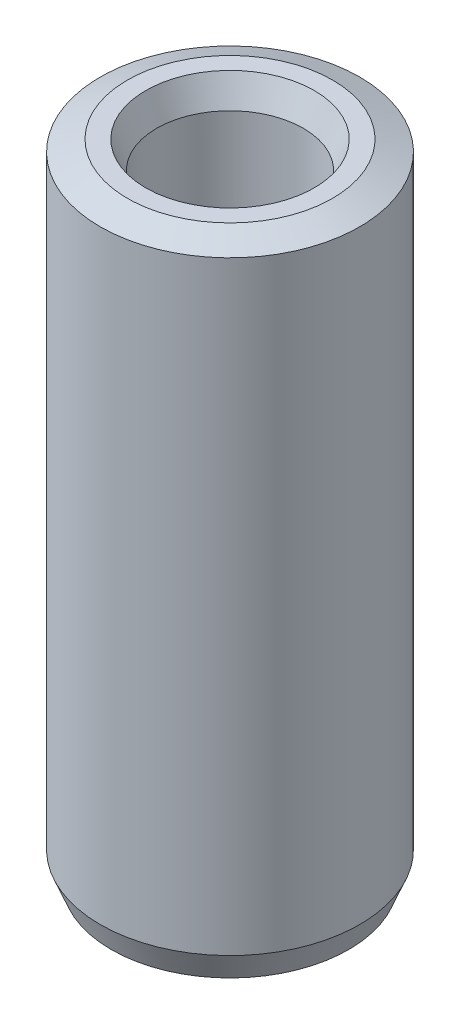
from build123d import *
from OCP.BRepFilletAPI import BRepFilletAPI_MakeChamfer

# Parameters (mm, degrees)
SKETCH1_R           = 42.5
BOSS_EXTRUDE1_DEPTH = 210.453476228
SKETCH2_R           = 24.009479227
CUT_EXTRUDE1_DEPTH  = 219.867918289
CHAMFER1_SIZE       = 3.603964877
CHAMFER1_SIZE2      = 8.904647738


with BuildPart() as part:
    # Sketch1 → Boss-Extrude1 (new body)
    with BuildSketch(Plane(origin=(0, 0, 0), x_dir=(1, 0, 0), z_dir=(0, 1, 0))):
        Circle(SKETCH1_R)
    extrude(amount=BOSS_EXTRUDE1_DEPTH)

    # Sketch2 → Cut-Extrude1 (cut, through all)
    with BuildSketch(Plane(origin=(0, 0, 0), x_dir=(1, 0, 0), z_dir=(0, 1, 0))):
        Circle(SKETCH2_R)
    extrude(amount=CUT_EXTRUDE1_DEPTH, mode=Mode.SUBTRACT)

    # Chamfer1: one chamfer whose edges measure the first distance from different faces: ONE call of the kernel's chamfer builder (chamfer() names one face for all edges)
    chamfer1_edges_1 = [part.edges().sort_by_distance(p)[0] for p in [
        (-24.009479227, 210.453476228, 0),
    ]]
    chamfer1_side_1 = [part.faces().sort_by_distance(p)[0] for p in [
        (-41.297918472, 210.453476228, 0),
    ]]
    chamfer1_edges_2 = [part.edges().sort_by_distance(p)[0] for p in [
        (-24.009479227, 0, 0),
    ]]
    chamfer1_side_2 = [part.faces().sort_by_distance(p)[0] for p in [
        (-24.009479227, 105.226738114, 0),
    ]]
    chamfer1_edges_3 = [part.edges().sort_by_distance(p)[0] for p in [
        (-42.5, 0, 0),
    ]]
    chamfer1_side_3 = [part.faces().sort_by_distance(p)[0] for p in [
        (-41.297918472, 0, 0),
    ]]
    chamfer1_edges_4 = [part.edges().sort_by_distance(p)[0] for p in [
        (-42.5, 210.453476228, 0),
    ]]
    chamfer1_side_4 = [part.faces().sort_by_distance(p)[0] for p in [
        (-42.5, 105.226738114, 0),
    ]]
    chamfer1 = BRepFilletAPI_MakeChamfer(part.part.solid().wrapped)
    for e in chamfer1_edges_1:
        chamfer1.Add(CHAMFER1_SIZE, CHAMFER1_SIZE2, e.wrapped, chamfer1_side_1[0].wrapped)  # the first distance lies on this face
    for e in chamfer1_edges_2:
        chamfer1.Add(CHAMFER1_SIZE, CHAMFER1_SIZE2, e.wrapped, chamfer1_side_2[0].wrapped)  # the first distance lies on this face
    for e in chamfer1_edges_3:
        chamfer1.Add(CHAMFER1_SIZE, CHAMFER1_SIZE2, e.wrapped, chamfer1_side_3[0].wrapped)  # the first distance lies on this face
    for e in chamfer1_edges_4:
        chamfer1.Add(CHAMFER1_SIZE, CHAMFER1_SIZE2, e.wrapped, chamfer1_side_4[0].wrapped)  # the first distance lies on this face
    add(Compound.cast(chamfer1.Shape()), mode=Mode.REPLACE)


solid = part.part
